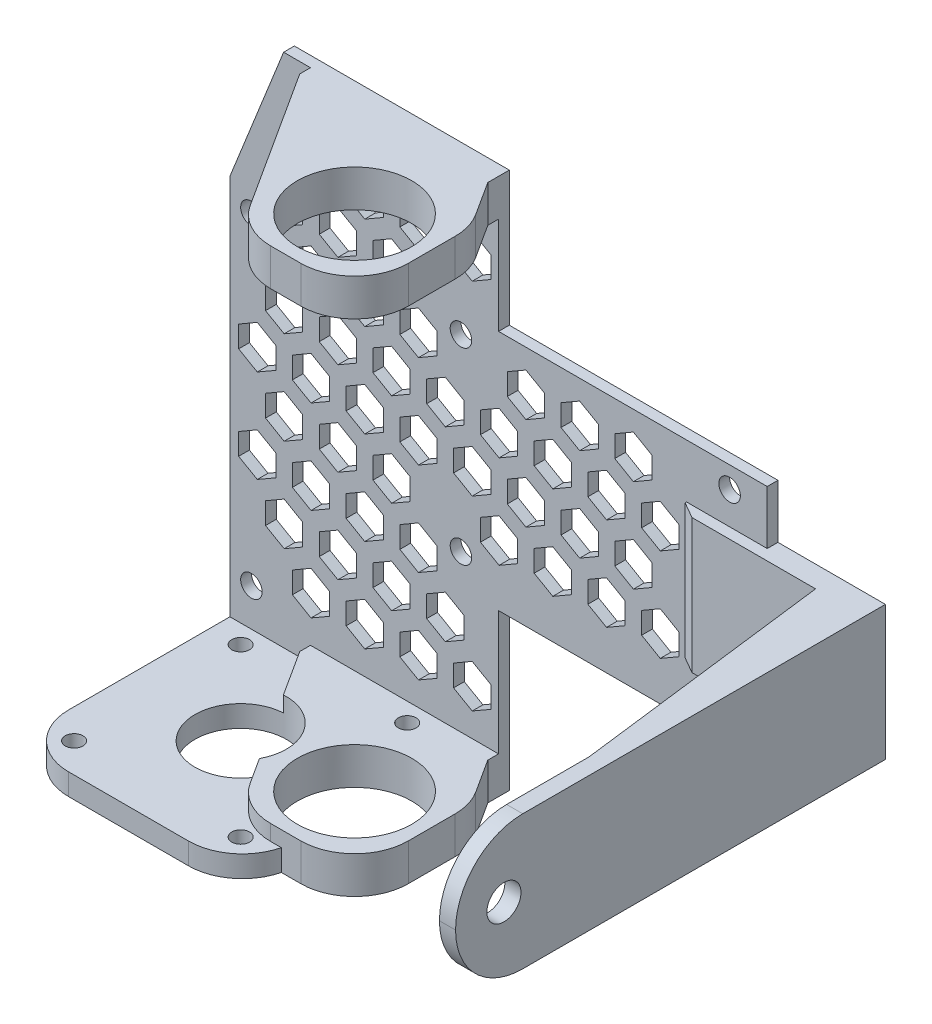
from build123d import *

# Parameters (mm, degrees)
BOSS_EXTRUDE1_DEPTH     = 2
SKETCH3_R               = 2
CUT_EXTRUDE1_DEPTH      = 10
BOSS_EXTRUDE2_DEPTH     = 6.9
FILLET2_R               = 10
SKETCH5_R               = 10.65
CUT_EXTRUDE2_DEPTH      = 10
FILLET2_OF_MIRROR1_R    = 10
BOSS_EXTRUDE3_DEPTH     = 4
CUT_EXTRUDE3_DEPTH      = 132.867357598
CUT_EXTRUDE3_DEPTH_BACK = 8
SKETCH7_R               = 8.5
SKETCH7_R_2             = 1.65
FILLET3_R               = 10
SKETCH9_W               = 4
SKETCH9_H               = 25
BOSS_EXTRUDE5_DEPTH     = 20
SKETCH12_W              = 80
SKETCH12_H              = 25
BOSS_EXTRUDE7_DEPTH     = 3
FILLET4_R               = 12.5
SKETCH13_R              = 3.175
CUT_EXTRUDE4_DEPTH      = 3
SKETCH14_W              = 48.147500413
SKETCH14_H              = 3
BOSS_EXTRUDE8_DEPTH     = 6
CUT_EXTRUDE5_DEPTH      = 138.931142241
SKETCH19_W              = 2
SKETCH19_H              = 25
BOSS_EXTRUDE9_DEPTH     = 15
CHAMFER1_SIZE           = 3
CHAMFER1_SIZE2          = 1.732050808
FILL_PATTERN2_DEPTH     = 2


# Read off the part's stored shape, not the designer's step: Fill Pattern2
# Some blends are built 0.0001 mm under size
with BuildPart() as part:
    # Sketch1 → Boss-Extrude1 (new body)
    with BuildSketch(Plane.XY):
        Polygon((25, 25), (25, 50), (-15, 50), (-25, 25), (-25, -50), (25, -50), (25, -20), (75, -20), (75, 25), align=None)
    extrude(amount=BOSS_EXTRUDE1_DEPTH)

    # Sketch3 → Cut-Extrude1 (cut)
    with BuildSketch(Plane.XY.offset(2)):
        with Locations((68, 21)):
            Circle(SKETCH3_R)
        with Locations((68, -14)):
            Circle(SKETCH3_R)
        with Locations((-21, 21)):
            Circle(SKETCH3_R)
        with Locations((18, 21)):
            Circle(SKETCH3_R)
        with Locations((18, -14)):
            Circle(SKETCH3_R)
        with Locations((-21, -39)):
            Circle(SKETCH3_R)
    extrude(amount=-CUT_EXTRUDE1_DEPTH, mode=Mode.SUBTRACT)

    # Sketch4 → Boss-Extrude2 (add)
    with BuildSketch(Plane(origin=(0, 50, 0), x_dir=(1, 0, 0), z_dir=(0, 1, 0))):
        Polygon((-10, -4), (9.55995221, -34.427043772), (30.627059345, -34.427043772), (30.627059345, -12.753333298), (25, -4), (25, -2), (-10, -2), align=None)
    boss_extrude2 = extrude(amount=-BOSS_EXTRUDE2_DEPTH)

    # Fillet2
    fillet2_edges = [part.edges().sort_by_distance(p)[0] for p in [
        (30.627059345, 46.55, 12.753333298),
        (30.627059345, 46.55, 34.427043772),
        (9.55995221, 46.55, 34.427043772),
    ]]
    fillet(fillet2_edges, radius=FILLET2_R)

    # Sketch5 → Cut-Extrude2 (cut)
    with BuildSketch(Plane(origin=(0, 50, 0), x_dir=(1, 0, 0), z_dir=(0, 1, 0))):
        with Locations(Location((17.627059345, -21.427043772, 0), (0, 0, 180))):
            Circle(SKETCH5_R)
    cut_extrude2 = extrude(amount=-CUT_EXTRUDE2_DEPTH, mode=Mode.SUBTRACT)

    # Mirror1: Boss-Extrude2, Cut-Extrude2 across plane
    add(boss_extrude2.mirror(Plane.ZX))
    add(cut_extrude2.mirror(Plane.ZX), mode=Mode.SUBTRACT)

    # Fillet2 of Mirror1
    fillet2_of_mirror1_edges = [part.edges().sort_by_distance(p)[0] for p in [
        (30.627059345, -46.55, 12.753333298),
        (30.627059345, -46.55, 34.427043772),
        (9.55995221, -46.55, 34.427043772),
    ]]
    fillet(fillet2_of_mirror1_edges, radius=FILLET2_OF_MIRROR1_R)

    # Sketch6 → Boss-Extrude3 (add)
    with BuildSketch(Plane.XZ.offset(50)):
        Polygon((-25, 2), (-25, 42), (17, 42), (17, 34.427043772), (6.60768689, 29.834562914), (-10, 4), (-10, 2), align=None)
    extrude(amount=-BOSS_EXTRUDE3_DEPTH)

    # Sketch7 → Cut-Extrude3 (cut, two sides: drawn at the far end of the back side and taken through both)
    with BuildSketch(Plane.XZ.offset(50).offset(-CUT_EXTRUDE3_DEPTH_BACK)):
        with Locations(Location((-4, 21, 0), (0, 0, 266.456532937))):
            Circle(SKETCH7_R)
        with Locations(Location((-19.5, 36.5, 0), (0, 0, 180))):
            Circle(SKETCH7_R_2)
        with Locations(Location((11.5, 36.5, 0), (0, 0, 180))):
            Circle(SKETCH7_R_2)
        with Locations(Location((11.5, 5.5, 0), (0, 0, 180))):
            Circle(SKETCH7_R_2)
        with Locations(Location((-19.5, 5.5, 0), (0, 0, 180))):
            Circle(SKETCH7_R_2)
    extrude(amount=CUT_EXTRUDE3_DEPTH + CUT_EXTRUDE3_DEPTH_BACK, mode=Mode.SUBTRACT)

    # Fillet3
    # the kernel refuses this fillet: 10 mm, written as the material it takes off along each edge
    with BuildSketch(Plane(origin=(17, -74.252507413, 42), x_dir=(0, 0, -1), z_dir=(0, 1, 0))) as fillet3_piece_1:
        with BuildLine():
            CenterArc((10, 9.701002965), FILLET3_R, 180, 75.95378996)
            Line((0, 9.701002965), (-0.2, 9.701002965))
            Line((-0.2, 9.701002965), (-0.2, 0))
            Line((-0.2, 0), (0, -0.2))
            ThreePointArc((0, -0.2), (3.786478114, -0.2), (7.524415353, -0.194020059))
            Line((7.524415353, -0.194020059), (7.572956228, 0))
        make_face()
    extrude(amount=52.505014826, mode=Mode.SUBTRACT)
    with BuildSketch(Plane(origin=(-25, -75, 42), x_dir=(0, 0, -1), z_dir=(0, 1, 0))) as fillet3_piece_2:
        with BuildLine():
            CenterArc((FILLET3_R, -FILLET3_R), FILLET3_R, 90, 90)
            Line((0, -FILLET3_R), (-FILLET3_R * 0.02, -FILLET3_R))
            Line((-FILLET3_R * 0.02, -FILLET3_R), (-FILLET3_R * 0.02, FILLET3_R * 0.02))
            Line((-FILLET3_R * 0.02, FILLET3_R * 0.02), (FILLET3_R, FILLET3_R * 0.02))
            Line((FILLET3_R, FILLET3_R * 0.02), (FILLET3_R, 0))
        make_face()
    extrude(amount=54, mode=Mode.SUBTRACT)

    # Sketch9 → Boss-Extrude5 (add)
    with BuildSketch(Plane(origin=(75, 0, 0), x_dir=(0, 0, -1), z_dir=(1, 0, 0))):
        with Locations((-2, 2.5)):
            Rectangle(SKETCH9_W, SKETCH9_H)
    extrude(amount=BOSS_EXTRUDE5_DEPTH)

    # Sketch12 → Boss-Extrude7 (add)
    with BuildSketch(Plane(origin=(95, 0, 0), x_dir=(0, 0, -1), z_dir=(1, 0, 0))):
        with Locations((-40, 2.5)):
            Rectangle(SKETCH12_W, SKETCH12_H)
    extrude(amount=-BOSS_EXTRUDE7_DEPTH)

    # Fillet4
    fillet4_edges = [part.edges().sort_by_distance(p)[0] for p in [
        (93.5, 15, 80),
        (93.5, -10, 80),
    ]]
    fillet(fillet4_edges, radius=FILLET4_R - 0.0001)  # a hair under: the kernel refuses the full size

    # Sketch13 → Cut-Extrude4 (cut)
    with BuildSketch(Plane.ZY.offset(-92)):
        with Locations((71, 2.5)):
            Circle(SKETCH13_R)
    extrude(amount=-CUT_EXTRUDE4_DEPTH, mode=Mode.SUBTRACT)

    # Sketch14 → Boss-Extrude8 (add)
    with BuildSketch(Plane.ZY.offset(-92)):
        with Locations((28.073750207, 13.5)):
            Rectangle(SKETCH14_W, SKETCH14_H)
        with Locations((28.073750207, -8.5)):
            Rectangle(SKETCH14_W, SKETCH14_H)
    extrude(amount=BOSS_EXTRUDE8_DEPTH)

    # Sketch15 → Cut-Extrude5 (cut, through all)
    with BuildSketch(Plane.XZ.offset(10)):
        Polygon((92, 52.147500413), (86, 4), (86, 52.147500413), align=None)
    extrude(amount=-CUT_EXTRUDE5_DEPTH, mode=Mode.SUBTRACT)

    # Sketch19 → Boss-Extrude9 (add)
    with BuildSketch(Plane.ZY.offset(-75)):
        with Locations((3, 2.5)):
            Rectangle(SKETCH19_W, SKETCH19_H)
    extrude(amount=BOSS_EXTRUDE9_DEPTH)

    # Chamfer1
    chamfer1_edges = [part.edges().sort_by_distance(p)[0] for p in [
        (60, 2.5, 4),
    ]]
    chamfer1_side = [part.faces().sort_by_distance(p)[0] for p in [
        (75.387434555, 2.5, 4),
    ]]
    chamfer(chamfer1_edges, length=CHAMFER1_SIZE, length2=CHAMFER1_SIZE2, reference=chamfer1_side[0])

    # Fill Pattern2 outline → Fill Pattern2 (cut)
    with BuildSketch(Plane.XY):
        Polygon((55.093679269, 12.660254038), (51.629577654, 10.660254038), (51.629577654, 6.660254038), (55.093679269, 4.660254038), (58.557780884, 6.660254038), (58.557780884, 10.660254038), align=None)
        Polygon((40.093679269, 4), (36.629577654, 2), (36.629577654, -2), (40.093679269, -4), (43.557780884, -2), (43.557780884, 2), align=None)
        Polygon((25.093679269, -4.660254038), (21.629577654, -6.660254038), (21.629577654, -10.660254038), (25.093679269, -12.660254038), (28.557780884, -10.660254038), (28.557780884, -6.660254038), align=None)
        Polygon((10.093679269, -13.320508076), (6.629577654, -15.320508076), (6.629577654, -19.320508076), (10.093679269, -21.320508076), (13.557780884, -19.320508076), (13.557780884, -15.320508076), align=None)
        Polygon((-4.906320731, -21.980762114), (-8.370422346, -23.980762114), (-8.370422346, -27.980762114), (-4.906320731, -29.980762114), (-1.442219116, -27.980762114), (-1.442219116, -23.980762114), align=None)
        Polygon((51.629577654, -6.660254038), (51.629577654, -10.660254038), (55.093679269, -12.660254038), (58.557780884, -10.660254038), (58.557780884, -6.660254038), (55.093679269, -4.660254038), align=None)
        Polygon((6.629577654, 32.641016151), (10.093679269, 30.641016151), (13.557780884, 32.641016151), (13.557780884, 36.641016151), (10.093679269, 38.641016151), (6.629577654, 36.641016151), align=None)
        Polygon((36.629577654, 15.320508076), (40.093679269, 13.320508076), (43.557780884, 15.320508076), (43.557780884, 19.320508076), (40.093679269, 21.320508076), (36.629577654, 19.320508076), align=None)
        Polygon((20.093679269, 38.641016151), (16.629577654, 36.641016151), (16.629577654, 32.641016151), (20.093679269, 30.641016151), (23.557780884, 32.641016151), (23.557780884, 36.641016151), align=None)
        Polygon((5.093679269, 29.980762114), (1.629577654, 27.980762114), (1.629577654, 23.980762114), (5.093679269, 21.980762114), (8.557780884, 23.980762114), (8.557780884, 27.980762114), align=None)
        Polygon((-9.906320731, 21.320508076), (-13.370422346, 19.320508076), (-13.370422346, 15.320508076), (-9.906320731, 13.320508076), (-6.442219116, 15.320508076), (-6.442219116, 19.320508076), align=None)
        Polygon((16.629577654, 2), (16.629577654, -2), (20.093679269, -4), (23.557780884, -2), (23.557780884, 2), (20.093679269, 4), align=None)
        Polygon((16.629577654, -32.641016151), (16.629577654, -36.641016151), (20.093679269, -38.641016151), (23.557780884, -36.641016151), (23.557780884, -32.641016151), (20.093679269, -30.641016151), align=None)
        Polygon((46.629577654, 15.320508076), (50.093679269, 13.320508076), (53.557780884, 15.320508076), (53.557780884, 19.320508076), (50.093679269, 21.320508076), (46.629577654, 19.320508076), align=None)
        Polygon((1.629577654, -6.660254038), (1.629577654, -10.660254038), (5.093679269, -12.660254038), (8.557780884, -10.660254038), (8.557780884, -6.660254038), (5.093679269, -4.660254038), align=None)
        Polygon((1.629577654, 10.660254038), (1.629577654, 6.660254038), (5.093679269, 4.660254038), (8.557780884, 6.660254038), (8.557780884, 10.660254038), (5.093679269, 12.660254038), align=None)
        Polygon((1.629577654, -23.980762114), (1.629577654, -27.980762114), (5.093679269, -29.980762114), (8.557780884, -27.980762114), (8.557780884, -23.980762114), (5.093679269, -21.980762114), align=None)
        Polygon((-13.370422346, 32.641016151), (-9.906320731, 30.641016151), (-6.442219116, 32.641016151), (-6.442219116, 36.641016151), (-9.906320731, 38.641016151), (-13.370422346, 36.641016151), align=None)
        Polygon((46.629577654, -2), (50.093679269, -4), (53.557780884, -2), (53.557780884, 2), (50.093679269, 4), (46.629577654, 2), align=None)
        Polygon((31.629577654, 6.660254038), (35.093679269, 4.660254038), (38.557780884, 6.660254038), (38.557780884, 10.660254038), (35.093679269, 12.660254038), (31.629577654, 10.660254038), align=None)
        Polygon((-13.370422346, 2), (-13.370422346, -2), (-9.906320731, -4), (-6.442219116, -2), (-6.442219116, 2), (-9.906320731, 4), align=None)
        Polygon((-13.370422346, -32.641016151), (-13.370422346, -36.641016151), (-9.906320731, -38.641016151), (-6.442219116, -36.641016151), (-6.442219116, -32.641016151), (-9.906320731, -30.641016151), align=None)
        Polygon((-13.370422346, -15.320508076), (-13.370422346, -19.320508076), (-9.906320731, -21.320508076), (-6.442219116, -19.320508076), (-6.442219116, -15.320508076), (-9.906320731, -13.320508076), align=None)
        Polygon((0.093679269, 4), (-3.370422346, 2), (-3.370422346, -2), (0.093679269, -4), (3.557780884, -2), (3.557780884, 2), align=None)
        Polygon((-14.906320731, -4.660254038), (-18.370422346, -6.660254038), (-18.370422346, -10.660254038), (-14.906320731, -12.660254038), (-11.442219116, -10.660254038), (-11.442219116, -6.660254038), align=None)
        Polygon((30.093679269, 21.320508076), (26.629577654, 19.320508076), (26.629577654, 15.320508076), (30.093679269, 13.320508076), (33.557780884, 15.320508076), (33.557780884, 19.320508076), align=None)
        Polygon((15.093679269, 12.660254038), (11.629577654, 10.660254038), (11.629577654, 6.660254038), (15.093679269, 4.660254038), (18.557780884, 6.660254038), (18.557780884, 10.660254038), align=None)
        Polygon((-3.370422346, 36.641016151), (-3.370422346, 32.641016151), (0.093679269, 30.641016151), (3.557780884, 32.641016151), (3.557780884, 36.641016151), (0.093679269, 38.641016151), align=None)
        Polygon((-3.370422346, -32.641016151), (-3.370422346, -36.641016151), (0.093679269, -38.641016151), (3.557780884, -36.641016151), (3.557780884, -32.641016151), (0.093679269, -30.641016151), align=None)
        Polygon((-3.370422346, -15.320508076), (-3.370422346, -19.320508076), (0.093679269, -21.320508076), (3.557780884, -19.320508076), (3.557780884, -15.320508076), (0.093679269, -13.320508076), align=None)
        Polygon((-3.370422346, 19.320508076), (-3.370422346, 15.320508076), (0.093679269, 13.320508076), (3.557780884, 15.320508076), (3.557780884, 19.320508076), (0.093679269, 21.320508076), align=None)
        Polygon((-18.370422346, 6.660254038), (-14.906320731, 4.660254038), (-11.442219116, 6.660254038), (-11.442219116, 10.660254038), (-14.906320731, 12.660254038), (-18.370422346, 10.660254038), align=None)
        Polygon((-4.906320731, 29.980762114), (-8.370422346, 27.980762114), (-8.370422346, 23.980762114), (-4.906320731, 21.980762114), (-1.442219116, 23.980762114), (-1.442219116, 27.980762114), align=None)
        Polygon((-8.370422346, -6.660254038), (-8.370422346, -10.660254038), (-4.906320731, -12.660254038), (-1.442219116, -10.660254038), (-1.442219116, -6.660254038), (-4.906320731, -4.660254038), align=None)
        Polygon((-8.370422346, 10.660254038), (-8.370422346, 6.660254038), (-4.906320731, 4.660254038), (-1.442219116, 6.660254038), (-1.442219116, 10.660254038), (-4.906320731, 12.660254038), align=None)
        Polygon((6.629577654, 15.320508076), (10.093679269, 13.320508076), (13.557780884, 15.320508076), (13.557780884, 19.320508076), (10.093679269, 21.320508076), (6.629577654, 19.320508076), align=None)
        Polygon((21.629577654, 6.660254038), (25.093679269, 4.660254038), (28.557780884, 6.660254038), (28.557780884, 10.660254038), (25.093679269, 12.660254038), (21.629577654, 10.660254038), align=None)
        Polygon((10.093679269, 4), (6.629577654, 2), (6.629577654, -2), (10.093679269, -4), (13.557780884, -2), (13.557780884, 2), align=None)
        Polygon((-19.906320731, -13.320508076), (-23.370422346, -15.320508076), (-23.370422346, -19.320508076), (-19.906320731, -21.320508076), (-16.442219116, -19.320508076), (-16.442219116, -15.320508076), align=None)
        Polygon((-23.370422346, -2), (-19.906320731, -4), (-16.442219116, -2), (-16.442219116, 2), (-19.906320731, 4), (-23.370422346, 2), align=None)
        Polygon((-18.370422346, 27.980762114), (-18.370422346, 23.980762114), (-14.906320731, 21.980762114), (-11.442219116, 23.980762114), (-11.442219116, 27.980762114), (-14.906320731, 29.980762114), align=None)
        Polygon((-18.370422346, -23.980762114), (-18.370422346, -27.980762114), (-14.906320731, -29.980762114), (-11.442219116, -27.980762114), (-11.442219116, -23.980762114), (-14.906320731, -21.980762114), align=None)
        Polygon((11.629577654, -27.980762114), (15.093679269, -29.980762114), (18.557780884, -27.980762114), (18.557780884, -23.980762114), (15.093679269, -21.980762114), (11.629577654, -23.980762114), align=None)
        Polygon((26.629577654, -2), (30.093679269, -4), (33.557780884, -2), (33.557780884, 2), (30.093679269, 4), (26.629577654, 2), align=None)
        Polygon((41.629577654, -10.660254038), (45.093679269, -12.660254038), (48.557780884, -10.660254038), (48.557780884, -6.660254038), (45.093679269, -4.660254038), (41.629577654, -6.660254038), align=None)
        Polygon((31.629577654, -10.660254038), (35.093679269, -12.660254038), (38.557780884, -10.660254038), (38.557780884, -6.660254038), (35.093679269, -4.660254038), (31.629577654, -6.660254038), align=None)
        Polygon((41.629577654, 6.660254038), (45.093679269, 4.660254038), (48.557780884, 6.660254038), (48.557780884, 10.660254038), (45.093679269, 12.660254038), (41.629577654, 10.660254038), align=None)
        Polygon((10.093679269, -30.641016151), (6.629577654, -32.641016151), (6.629577654, -36.641016151), (10.093679269, -38.641016151), (13.557780884, -36.641016151), (13.557780884, -32.641016151), align=None)
    extrude(amount=FILL_PATTERN2_DEPTH, mode=Mode.SUBTRACT)


solid = part.part
